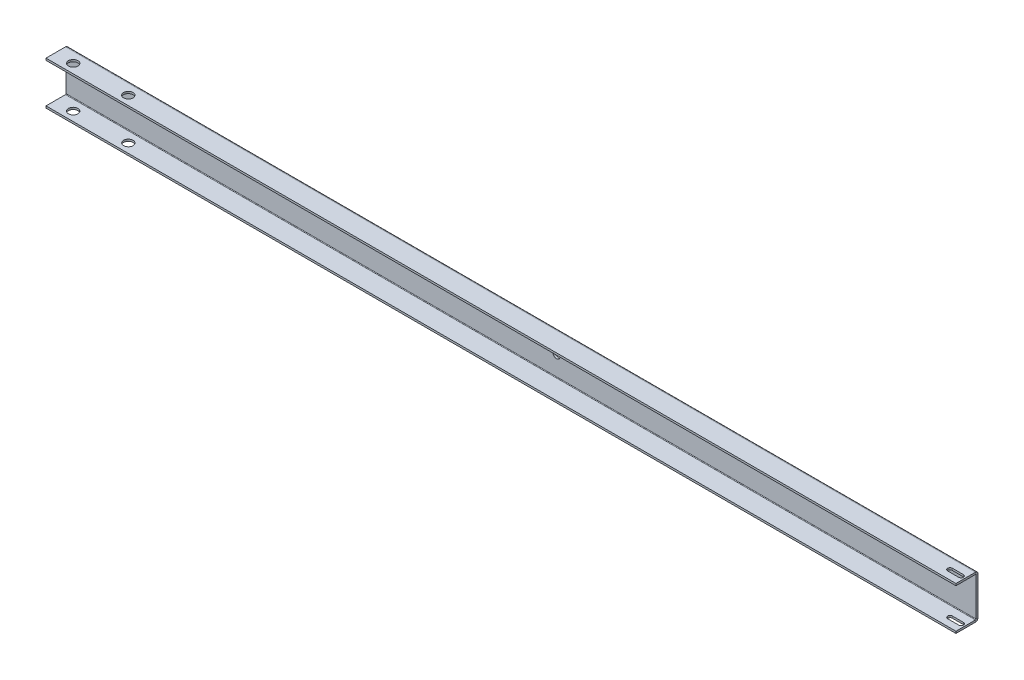
from build123d import *

# Parameters (mm, degrees)
SKETCH1_W                      = 1155
SKETCH1_H                      = 55
BASE_FLANGE1_DEPTH             = 2.5
EDGE_FLANGE1_STRIP_W           = 11.4732
EDGE_FLANGE1_STRIP_H           = 2.5
EDGE_FLANGE1_STRIP_CUT_DEPTH   = 1155
EDGE_FLANGE1_STRIP_2_W         = 11.4732
EDGE_FLANGE1_STRIP_2_H         = 2.5
EDGE_FLANGE1_STRIP_CUT_2_DEPTH = 1155
EDGE_FLANGE1_DEPTH             = 1155
EDGE_FLANGE1_BEND_DEPTH        = 1155
CUT_EXTRUDE1_DEPTH             = 581.673316074
CUT_EXTRUDE1_DEPTH_BACK        = 581.673316074
SKETCH13_R                     = 6
CUT_EXTRUDE2_DEPTH             = 581.673316074
LPATTERN1_COUNT                = 2
LPATTERN1_PITCH                = 70
SKETCH14_R                     = 4.5
CUT_EXTRUDE3_DEPTH             = 10


# Sheet-metal steps are written as plain solids
with BuildPart() as part:
    # Sketch1 → Base-Flange1 (new body)
    with BuildSketch(Plane.XY):
        Rectangle(SKETCH1_W, SKETCH1_H)
    extrude(amount=-BASE_FLANGE1_DEPTH)

    # Edge-Flange1 strip (across the edge) → Edge-Flange1 strip cut (cut)
    with BuildSketch(Plane(origin=(577.5, 27.5, 0), x_dir=(0, -1, 0), z_dir=(-1, 0, 0))):
        with Locations((-2.5, -1.25)):
            Rectangle(EDGE_FLANGE1_STRIP_W, EDGE_FLANGE1_STRIP_H)
    extrude(amount=EDGE_FLANGE1_STRIP_CUT_DEPTH, mode=Mode.SUBTRACT)

    # Edge-Flange1 strip 2 (across the edge) → Edge-Flange1 strip cut 2 (cut)
    with BuildSketch(Plane(origin=(-577.5, -27.5, 0), x_dir=(0, 1, 0), z_dir=(1, 0, 0))):
        with Locations((-2.5, -1.25)):
            Rectangle(EDGE_FLANGE1_STRIP_2_W, EDGE_FLANGE1_STRIP_2_H)
    extrude(amount=EDGE_FLANGE1_STRIP_CUT_2_DEPTH, mode=Mode.SUBTRACT)

    # Edge-Flange1 section (across the edge) → Edge-Flange1 (add)
    with BuildSketch(Plane(origin=(577.5, 27.5, 0), x_dir=(0, -1, 0), z_dir=(-1, 0, 0))):
        with BuildLine():
            Line((0, 0.7366), (0, 25.5))
            Line((0, 25.5), (2.5, 25.5))
            Line((2.5, 25.5), (2.5, 0.7366))
            ThreePointArc((2.5, 0.7366), (2.715745145, 0.215745145), (3.2366, 0))
            Line((3.2366, 0), (3.2366, -2.5))
            ThreePointArc((3.2366, -2.5), (0.947978192, -1.552021808), (0, 0.7366))
        make_face()
    extrude(amount=EDGE_FLANGE1_DEPTH)

    # Edge-Flange1 section 2 (across the edge) → Edge-Flange1 bend (add)
    with BuildSketch(Plane(origin=(-577.5, -27.5, 0), x_dir=(0, 1, 0), z_dir=(1, 0, 0))):
        with BuildLine():
            Line((0, 0.7366), (0, 25.5))
            Line((0, 25.5), (2.5, 25.5))
            Line((2.5, 25.5), (2.5, 0.7366))
            ThreePointArc((2.5, 0.7366), (2.715745145, 0.215745145), (3.2366, 0))
            Line((3.2366, 0), (3.2366, -2.5))
            ThreePointArc((3.2366, -2.5), (0.947978192, -1.552021808), (0, 0.7366))
        make_face()
    extrude(amount=EDGE_FLANGE1_BEND_DEPTH)

    # Sketch12 → Cut-Extrude1 (cut, two sides: drawn at the far end of the back side and taken through both)
    with BuildSketch(Plane(origin=(0, 27.5, 0), x_dir=(1, 0, 0), z_dir=(0, 1, 0)).offset(-CUT_EXTRUDE1_DEPTH_BACK)):
        with BuildLine():
            Line((572.5, -17), (558.5, -17))
            ThreePointArc((558.5, -17), (555.5, -14), (558.5, -11))
            Line((558.5, -11), (572.5, -11))
            ThreePointArc((572.5, -11), (575.5, -14), (572.5, -17))
        make_face()
    extrude(amount=CUT_EXTRUDE1_DEPTH + CUT_EXTRUDE1_DEPTH_BACK, mode=Mode.SUBTRACT)

    # Sketch13 → Cut-Extrude2 (cut, symmetric)
    with BuildSketch(Plane(origin=(0, 27.5, 0), x_dir=(1, 0, 0), z_dir=(0, 1, 0))):
        with Locations(Location((-554.5, -14, 0), (0, 0, 270))):
            Circle(SKETCH13_R)
    cut_extrude2 = extrude(amount=CUT_EXTRUDE2_DEPTH, both=True, mode=Mode.SUBTRACT)

    # LPattern1: Cut-Extrude2 ×2
    with Locations(*[(i * LPATTERN1_PITCH, 0, 0) for i in range(1, LPATTERN1_COUNT)]):
        add(cut_extrude2, mode=Mode.SUBTRACT)

    # Sketch14 → Cut-Extrude3 (cut)
    with BuildSketch(Plane.XY):
        with Locations((44.9385, 0)):
            Circle(SKETCH14_R)
    extrude(amount=-CUT_EXTRUDE3_DEPTH, mode=Mode.SUBTRACT)


solid = part.part
